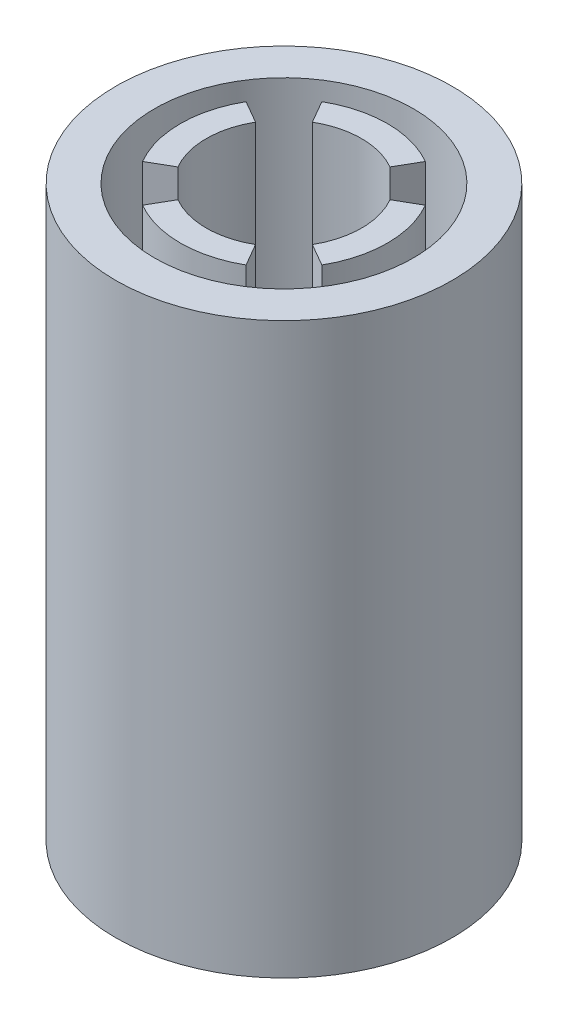
from build123d import *

# Parameters (mm, degrees)
SKETCH1_R           = 6.5
BOSS_EXTRUDE1_DEPTH = 22
CAVITY1_START       = 2
CAVITY1_OUTLINE_R   = 5
CAVITY1_OUTLINE_R_2 = 0.75
CAVITY1_DEPTH       = 20
CAVITY1_START_2     = 17
CAVITY1_2_OUTLINE_R = 0.75
CAVITY1_2_DEPTH     = 5
SKETCH2_R           = 0.3
CUT_EXTRUDE1_DEPTH  = 23.011360703


# Read off the part's stored shape, not the designer's step: Cavity1
with BuildPart() as part:
    # Sketch1 → Boss-Extrude1 (new body)
    with BuildSketch(Plane(origin=(0, 0, 0), x_dir=(1, 0, 0), z_dir=(0, 1, 0))):
        with Locations(Location((0, 0, 0), (0, 0, 270))):
            Circle(SKETCH1_R)
    extrude(amount=BOSS_EXTRUDE1_DEPTH)

    # Cavity1 outline → Cavity1 (cut)
    with BuildSketch(Plane(origin=(0, 0, 0), x_dir=(1, 0, 0), z_dir=(0, 1, 0)).offset(CAVITY1_START)):
        Circle(CAVITY1_OUTLINE_R)
        with BuildLine():
            ThreePointArc((-1.5, -2.598076211), (0, -3), (1.5, -2.598076211))
            Line((1.5, -2.598076211), (2, -3.464101615))
            ThreePointArc((2, -3.464101615), (0, -4), (-2, -3.464101615))
            Line((-2, -3.464101615), (-1.5, -2.598076211))
        make_face(mode=Mode.SUBTRACT)
        with BuildLine():
            ThreePointArc((-2.598076211, 1.5), (-3, 0), (-2.598076211, -1.5))
            Line((-2.598076211, -1.5), (-3.464101615, -2))
            ThreePointArc((-3.464101615, -2), (-4, 0), (-3.464101615, 2))
            Line((-3.464101615, 2), (-2.598076211, 1.5))
        make_face(mode=Mode.SUBTRACT)
        Circle(CAVITY1_OUTLINE_R_2, mode=Mode.SUBTRACT)
        with BuildLine():
            ThreePointArc((2.598076211, -1.5), (3, 0), (2.598076211, 1.5))
            Line((2.598076211, 1.5), (3.464101615, 2))
            ThreePointArc((3.464101615, 2), (4, 0), (3.464101615, -2))
            Line((3.464101615, -2), (2.598076211, -1.5))
        make_face(mode=Mode.SUBTRACT)
        with BuildLine():
            ThreePointArc((1.5, 2.598076211), (0, 3), (-1.5, 2.598076211))
            Line((-1.5, 2.598076211), (-2, 3.464101615))
            ThreePointArc((-2, 3.464101615), (0, 4), (2, 3.464101615))
            Line((2, 3.464101615), (1.5, 2.598076211))
        make_face(mode=Mode.SUBTRACT)
    extrude(amount=CAVITY1_DEPTH, mode=Mode.SUBTRACT)

    # Cavity1 2 outline → Cavity1 2 (cut)
    with BuildSketch(Plane(origin=(0, 0, 0), x_dir=(1, 0, 0), z_dir=(0, 1, 0)).offset(CAVITY1_START_2)):
        Circle(CAVITY1_2_OUTLINE_R)
    extrude(amount=CAVITY1_2_DEPTH, mode=Mode.SUBTRACT)

    # Sketch2 → Cut-Extrude1 (cut, through all)
    with BuildSketch(Plane(origin=(0, 2, 0), x_dir=(1, 0, 0), z_dir=(0, 1, 0))):
        with Locations(Location((0, 4.5, 0), (0, 0, 270))):
            Circle(SKETCH2_R)
        with Locations(Location((4.5, 0, 0), (0, 0, 270))):
            Circle(SKETCH2_R)
        with Locations(Location((0, -4.5, 0), (0, 0, 270))):
            Circle(SKETCH2_R)
        with Locations(Location((-4.5, 0, 0), (0, 0, 270))):
            Circle(SKETCH2_R)
    extrude(amount=-CUT_EXTRUDE1_DEPTH, mode=Mode.SUBTRACT)


solid = part.part
